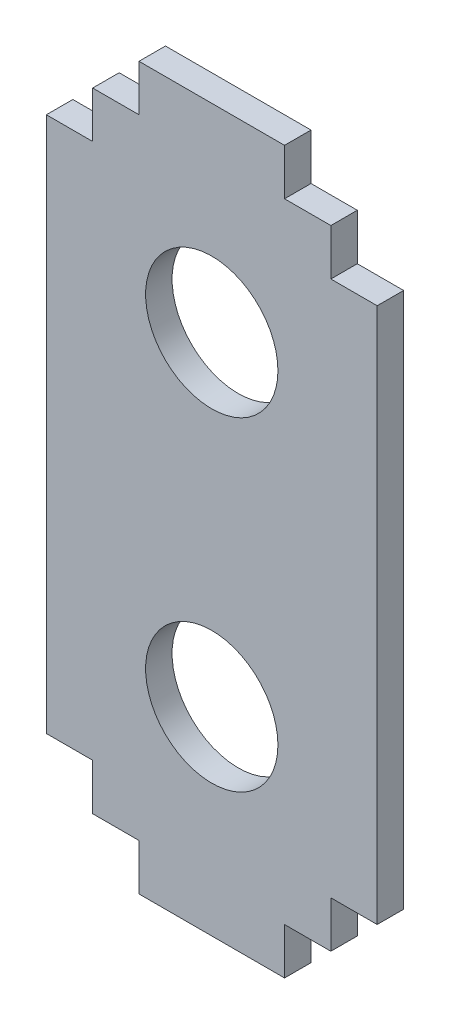
from build123d import *

# Parameters (mm, degrees)
SKETCH_1_R             = 10
SM_BASE_FLANGE_1_DEPTH = 4


# Sheet-metal steps are written as plain solids
with BuildPart() as part:
    # Sketch 1 → Базовая кромка1 (new body)
    with BuildSketch(Plane.XY):
        Polygon((-25, 16), (-25, -65), (-18, -65), (-18, -72), (-11, -72), (-11, -79), (11, -79), (11, -72), (18, -72), (18, -65), (25, -65), (25, 16), (18, 16), (18, 23), (11, 23), (11, 30), (-11, 30), (-11, 23), (-18, 23), (-18, 16), align=None)
        Circle(SKETCH_1_R, mode=Mode.SUBTRACT)
        with Locations((0, -49)):
            Circle(SKETCH_1_R, mode=Mode.SUBTRACT)
    extrude(amount=-SM_BASE_FLANGE_1_DEPTH)


solid = part.part
